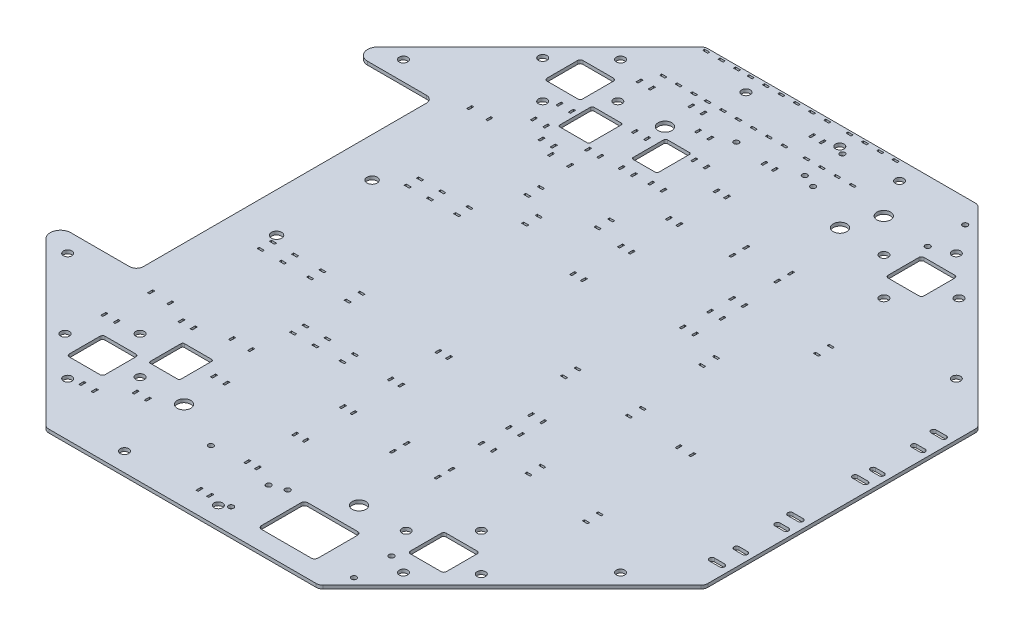
from build123d import *

# Parameters (mm, degrees)
SKETCH_1_R          = 2.5
SKETCH_1_R_2        = 4
SKETCH_1_R_3        = 3
SKETCH_1_R_4        = 1.5
SKETCH_1_W          = 3
SKETCH_1_H          = 1.2
SKETCH_1_W_2        = 1.2
SKETCH_1_H_2        = 3
EXTRUDE_1_DEPTH     = 2
CUT_EXTRUDE_1_DEPTH = 2


with BuildPart() as part:
    # 草图1 → 凸台-拉伸1 (new body)
    with BuildSketch(Plane.XZ):
        with BuildLine():
            Line((-175.894444303, -97.242640687), (-81.171572875, -191.965512115))
            ThreePointArc((-81.171572875, -191.965512115), (-79.87387948, -192.83260312), (-78.343145751, -193.13708499))
            Line((-78.343145751, -193.13708499), (78.343145751, -193.13708499))
            ThreePointArc((78.343145751, -193.13708499), (79.87387948, -192.83260312), (81.171572875, -191.965512115))
            Line((81.171572875, -191.965512115), (191.965512115, -81.171572875))
            ThreePointArc((191.965512115, -81.171572875), (192.83260312, -79.87387948), (193.13708499, -78.343145751))
            Line((193.13708499, -78.343145751), (193.13708499, 78.343145751))
            ThreePointArc((193.13708499, 78.343145751), (192.83260312, 79.87387948), (191.965512115, 81.171572875))
            Line((191.965512115, 81.171572875), (81.171572875, 191.965512115))
            ThreePointArc((81.171572875, 191.965512115), (79.87387948, 192.83260312), (78.343145751, 193.13708499))
            Line((78.343145751, 193.13708499), (-78.343145751, 193.13708499))
            ThreePointArc((-78.343145751, 193.13708499), (-79.87387948, 192.83260312), (-81.171572875, 191.965512115))
            Line((-81.171572875, 191.965512115), (-175.894444303, 97.242640687))
            ThreePointArc((-175.894444303, 97.242640687), (-177.195080811, 90.703899406), (-171.651803616, 87))
            Line((-171.651803616, 87), (-137.13708499, 87))
            ThreePointArc((-137.13708499, 87), (-134.308657865, 85.828427125), (-133.13708499, 83))
            Line((-133.13708499, 83), (-133.13708499, -83))
            ThreePointArc((-133.13708499, -83), (-134.308657865, -85.828427125), (-137.13708499, -87))
            Line((-137.13708499, -87), (-171.651803616, -87))
            ThreePointArc((-171.651803616, -87), (-177.195080811, -90.703899406), (-175.894444303, -97.242640687))
        make_face()
        with Locations((-45, -182.13708499)):
            Circle(SKETCH_1_R, mode=Mode.SUBTRACT)
        with Locations((45, -182.13708499)):
            Circle(SKETCH_1_R, mode=Mode.SUBTRACT)
        with Locations((-98.384776311, 162.024386618)):
            Circle(SKETCH_1_R, mode=Mode.SUBTRACT)
        with Locations((-162.024386618, 98.384776311)):
            Circle(SKETCH_1_R, mode=Mode.SUBTRACT)
        with Locations((162.024386618, -98.384776311)):
            Circle(SKETCH_1_R, mode=Mode.SUBTRACT)
        with Locations((98.384776311, -162.024386618)):
            Circle(SKETCH_1_R, mode=Mode.SUBTRACT)
        with Locations((-162.024386618, -98.384776311)):
            Circle(SKETCH_1_R, mode=Mode.SUBTRACT)
        with Locations((-98.384776311, -162.024386618)):
            Circle(SKETCH_1_R, mode=Mode.SUBTRACT)
        with Locations((98.384776311, 162.024386618)):
            Circle(SKETCH_1_R, mode=Mode.SUBTRACT)
        with Locations((162.024386618, 98.384776311)):
            Circle(SKETCH_1_R, mode=Mode.SUBTRACT)
        with Locations((-45, 182.13708499)):
            Circle(SKETCH_1_R, mode=Mode.SUBTRACT)
        with Locations((-78, -140)):
            Circle(SKETCH_1_R, mode=Mode.SUBTRACT)
        with Locations((-100, -118)):
            Circle(SKETCH_1_R, mode=Mode.SUBTRACT)
        with Locations((-78, 140)):
            Circle(SKETCH_1_R, mode=Mode.SUBTRACT)
        with Locations((-100, 118)):
            Circle(SKETCH_1_R, mode=Mode.SUBTRACT)
        with Locations((100, 118)):
            Circle(SKETCH_1_R, mode=Mode.SUBTRACT)
        with Locations((100, -118)):
            Circle(SKETCH_1_R, mode=Mode.SUBTRACT)
        with Locations((-122, -140)):
            Circle(SKETCH_1_R, mode=Mode.SUBTRACT)
        with Locations((-122, 140)):
            Circle(SKETCH_1_R, mode=Mode.SUBTRACT)
        with Locations((78, 140)):
            Circle(SKETCH_1_R, mode=Mode.SUBTRACT)
        with Locations((122, 140)):
            Circle(SKETCH_1_R, mode=Mode.SUBTRACT)
        with Locations((78, -140)):
            Circle(SKETCH_1_R, mode=Mode.SUBTRACT)
        with Locations((122, -140)):
            Circle(SKETCH_1_R, mode=Mode.SUBTRACT)
        with Locations((10, 182.13708499)):
            Circle(SKETCH_1_R, mode=Mode.SUBTRACT)
        with Locations((10, -182.13708499)):
            Circle(SKETCH_1_R, mode=Mode.SUBTRACT)
        with Locations((51.303021499, -140.953893118)):
            Circle(SKETCH_1_R_2, mode=Mode.SUBTRACT)
        with Locations((58.143424365, -159.747745534)):
            Circle(SKETCH_1_R_2, mode=Mode.SUBTRACT)
        with Locations((-51.303021499, -140.953893118)):
            Circle(SKETCH_1_R_2, mode=Mode.SUBTRACT)
        with Locations((-51.303021499, 140.953893118)):
            Circle(SKETCH_1_R_2, mode=Mode.SUBTRACT)
        with Locations((51.303021499, 140.953893118)):
            Circle(SKETCH_1_R_2, mode=Mode.SUBTRACT)
        with Locations((-110, 28)):
            Circle(SKETCH_1_R_3, mode=Mode.SUBTRACT)
        with Locations((-110, -28)):
            Circle(SKETCH_1_R_3, mode=Mode.SUBTRACT)
        with Locations((-22.5, 154)):
            Circle(SKETCH_1_R_4, mode=Mode.SUBTRACT)
        with Locations((22.5, 154)):
            Circle(SKETCH_1_R_4, mode=Mode.SUBTRACT)
        with Locations((-22.5, -154)):
            Circle(SKETCH_1_R_4, mode=Mode.SUBTRACT)
        with Locations((22.5, -154)):
            Circle(SKETCH_1_R_4, mode=Mode.SUBTRACT)
        with Locations((86.5, -179.13708499)):
            Circle(SKETCH_1_R_4, mode=Mode.SUBTRACT)
        with Locations((14.5, -179.13708499)):
            Circle(SKETCH_1_R_4, mode=Mode.SUBTRACT)
        with Locations((86.5, -157.13708499)):
            Circle(SKETCH_1_R_4, mode=Mode.SUBTRACT)
        with Locations((14.5, -157.13708499)):
            Circle(SKETCH_1_R_4, mode=Mode.SUBTRACT)
        with Locations((86.5, 179.13708499)):
            Circle(SKETCH_1_R_4, mode=Mode.SUBTRACT)
        with Locations((14.5, 179.13708499)):
            Circle(SKETCH_1_R_4, mode=Mode.SUBTRACT)
        with Locations((86.5, 157.13708499)):
            Circle(SKETCH_1_R_4, mode=Mode.SUBTRACT)
        with Locations((14.5, 157.13708499)):
            Circle(SKETCH_1_R_4, mode=Mode.SUBTRACT)
        with BuildLine():
            Line((182.13708499, -63.5), (188.13708499, -63.5))
            ThreePointArc((188.13708499, -63.5), (189.63708499, -65), (188.13708499, -66.5))
            Line((188.13708499, -66.5), (182.13708499, -66.5))
            ThreePointArc((182.13708499, -66.5), (180.63708499, -65), (182.13708499, -63.5))
        make_face(mode=Mode.SUBTRACT)
        with BuildLine():
            Line((182.13708499, -17.5), (188.13708499, -17.5))
            ThreePointArc((188.13708499, -17.5), (189.63708499, -19), (188.13708499, -20.5))
            Line((188.13708499, -20.5), (182.13708499, -20.5))
            ThreePointArc((182.13708499, -20.5), (180.63708499, -19), (182.13708499, -17.5))
        make_face(mode=Mode.SUBTRACT)
        with BuildLine():
            Line((182.13708499, 66.5), (188.13708499, 66.5))
            ThreePointArc((188.13708499, 66.5), (189.63708499, 65), (188.13708499, 63.5))
            Line((188.13708499, 63.5), (182.13708499, 63.5))
            ThreePointArc((182.13708499, 63.5), (180.63708499, 65), (182.13708499, 66.5))
        make_face(mode=Mode.SUBTRACT)
        with BuildLine():
            Line((182.13708499, 20.5), (188.13708499, 20.5))
            ThreePointArc((188.13708499, 20.5), (189.63708499, 19), (188.13708499, 17.5))
            Line((188.13708499, 17.5), (182.13708499, 17.5))
            ThreePointArc((182.13708499, 17.5), (180.63708499, 19), (182.13708499, 20.5))
        make_face(mode=Mode.SUBTRACT)
        with BuildLine():
            Line((183.63708499, 53.5), (188.63708499, 53.5))
            ThreePointArc((188.63708499, 53.5), (190.13708499, 52), (188.63708499, 50.5))
            Line((188.63708499, 50.5), (183.63708499, 50.5))
            ThreePointArc((183.63708499, 50.5), (182.13708499, 52), (183.63708499, 53.5))
        make_face(mode=Mode.SUBTRACT)
        with BuildLine():
            Line((188.63708499, 26.5), (183.63708499, 26.5))
            ThreePointArc((183.63708499, 26.5), (182.13708499, 28), (183.63708499, 29.5))
            Line((183.63708499, 29.5), (188.63708499, 29.5))
            ThreePointArc((188.63708499, 29.5), (190.13708499, 28), (188.63708499, 26.5))
        make_face(mode=Mode.SUBTRACT)
        with BuildLine():
            Line((188.63708499, -53.5), (183.63708499, -53.5))
            ThreePointArc((183.63708499, -53.5), (182.13708499, -52), (183.63708499, -50.5))
            Line((183.63708499, -50.5), (188.63708499, -50.5))
            ThreePointArc((188.63708499, -50.5), (190.13708499, -52), (188.63708499, -53.5))
        make_face(mode=Mode.SUBTRACT)
        with BuildLine():
            Line((183.63708499, -26.5), (188.63708499, -26.5))
            ThreePointArc((188.63708499, -26.5), (190.13708499, -28), (188.63708499, -29.5))
            Line((188.63708499, -29.5), (183.63708499, -29.5))
            ThreePointArc((183.63708499, -29.5), (182.13708499, -28), (183.63708499, -26.5))
        make_face(mode=Mode.SUBTRACT)
        with BuildLine():
            Line((-45, -134), (-45, -116))
            ThreePointArc((-45, -116), (-44.707106781, -115.292893219), (-44, -115))
            Line((-44, -115), (-31, -115))
            ThreePointArc((-31, -115), (-30.292893219, -115.292893219), (-30, -116))
            Line((-30, -116), (-30, -134))
            ThreePointArc((-30, -134), (-30.292893219, -134.707106781), (-31, -135))
            Line((-31, -135), (-44, -135))
            ThreePointArc((-44, -135), (-44.707106781, -134.707106781), (-45, -134))
        make_face(mode=Mode.SUBTRACT)
        with Locations((-96.5, -42.6)):
            Rectangle(SKETCH_1_W, SKETCH_1_H, mode=Mode.SUBTRACT)
        with Locations((-96.5, -35.4)):
            Rectangle(SKETCH_1_W, SKETCH_1_H, mode=Mode.SUBTRACT)
        with Locations((-83.5, -42.6)):
            Rectangle(SKETCH_1_W, SKETCH_1_H, mode=Mode.SUBTRACT)
        with Locations((-83.5, -35.4)):
            Rectangle(SKETCH_1_W, SKETCH_1_H, mode=Mode.SUBTRACT)
        with Locations((-67.5, -42.6)):
            Rectangle(SKETCH_1_W, SKETCH_1_H, mode=Mode.SUBTRACT)
        with Locations((-67.5, -35.4)):
            Rectangle(SKETCH_1_W, SKETCH_1_H, mode=Mode.SUBTRACT)
        with Locations((-55.5, 65.6)):
            Rectangle(SKETCH_1_W, SKETCH_1_H, mode=Mode.SUBTRACT)
        with Locations((-55.5, 72.8)):
            Rectangle(SKETCH_1_W, SKETCH_1_H, mode=Mode.SUBTRACT)
        with Locations((-42.5, 65.6)):
            Rectangle(SKETCH_1_W, SKETCH_1_H, mode=Mode.SUBTRACT)
        with Locations((-42.5, 72.8)):
            Rectangle(SKETCH_1_W, SKETCH_1_H, mode=Mode.SUBTRACT)
        with Locations((-26.5, 65.6)):
            Rectangle(SKETCH_1_W, SKETCH_1_H, mode=Mode.SUBTRACT)
        with Locations((-26.5, 72.8)):
            Rectangle(SKETCH_1_W, SKETCH_1_H, mode=Mode.SUBTRACT)
        with Locations((-107.5, 32.6)):
            Rectangle(SKETCH_1_W, SKETCH_1_H, mode=Mode.SUBTRACT)
        with Locations((-107.5, 39.8)):
            Rectangle(SKETCH_1_W, SKETCH_1_H, mode=Mode.SUBTRACT)
        with Locations((-94.5, 32.6)):
            Rectangle(SKETCH_1_W, SKETCH_1_H, mode=Mode.SUBTRACT)
        with Locations((-94.5, 39.8)):
            Rectangle(SKETCH_1_W, SKETCH_1_H, mode=Mode.SUBTRACT)
        with Locations((-78.5, 32.6)):
            Rectangle(SKETCH_1_W, SKETCH_1_H, mode=Mode.SUBTRACT)
        with Locations((-78.5, 39.8)):
            Rectangle(SKETCH_1_W, SKETCH_1_H, mode=Mode.SUBTRACT)
        with Locations((62.8, -73.5)):
            Rectangle(SKETCH_1_W_2, SKETCH_1_H_2, mode=Mode.SUBTRACT)
        with Locations((55.6, -73.5)):
            Rectangle(SKETCH_1_W_2, SKETCH_1_H_2, mode=Mode.SUBTRACT)
        with Locations((62.8, -60.5)):
            Rectangle(SKETCH_1_W_2, SKETCH_1_H_2, mode=Mode.SUBTRACT)
        with Locations((55.6, -60.5)):
            Rectangle(SKETCH_1_W_2, SKETCH_1_H_2, mode=Mode.SUBTRACT)
        with Locations((62.8, -44.5)):
            Rectangle(SKETCH_1_W_2, SKETCH_1_H_2, mode=Mode.SUBTRACT)
        with Locations((55.6, -44.5)):
            Rectangle(SKETCH_1_W_2, SKETCH_1_H_2, mode=Mode.SUBTRACT)
        with Locations((62.8, 44.5)):
            Rectangle(SKETCH_1_W_2, SKETCH_1_H_2, mode=Mode.SUBTRACT)
        with Locations((55.6, 44.5)):
            Rectangle(SKETCH_1_W_2, SKETCH_1_H_2, mode=Mode.SUBTRACT)
        with Locations((62.8, 57.5)):
            Rectangle(SKETCH_1_W_2, SKETCH_1_H_2, mode=Mode.SUBTRACT)
        with Locations((55.6, 57.5)):
            Rectangle(SKETCH_1_W_2, SKETCH_1_H_2, mode=Mode.SUBTRACT)
        with Locations((62.8, 73.5)):
            Rectangle(SKETCH_1_W_2, SKETCH_1_H_2, mode=Mode.SUBTRACT)
        with Locations((55.6, 73.5)):
            Rectangle(SKETCH_1_W_2, SKETCH_1_H_2, mode=Mode.SUBTRACT)
        with Locations((-70.6, 93.5)):
            Rectangle(SKETCH_1_W_2, SKETCH_1_H_2, mode=Mode.SUBTRACT)
        with Locations((-59.4, 93.5)):
            Rectangle(SKETCH_1_W_2, SKETCH_1_H_2, mode=Mode.SUBTRACT)
        with Locations((-106.8, 93.5)):
            Rectangle(SKETCH_1_W_2, SKETCH_1_H_2, mode=Mode.SUBTRACT)
        with Locations((-118, 93.5)):
            Rectangle(SKETCH_1_W_2, SKETCH_1_H_2, mode=Mode.SUBTRACT)
        with Locations((-70.6, -93.5)):
            Rectangle(SKETCH_1_W_2, SKETCH_1_H_2, mode=Mode.SUBTRACT)
        with Locations((-59.4, -93.5)):
            Rectangle(SKETCH_1_W_2, SKETCH_1_H_2, mode=Mode.SUBTRACT)
        with Locations((-106.8, -93.5)):
            Rectangle(SKETCH_1_W_2, SKETCH_1_H_2, mode=Mode.SUBTRACT)
        with Locations((-118, -93.5)):
            Rectangle(SKETCH_1_W_2, SKETCH_1_H_2, mode=Mode.SUBTRACT)
        with Locations((-3.6, 151.5)):
            Rectangle(SKETCH_1_W_2, SKETCH_1_H_2, mode=Mode.SUBTRACT)
        with Locations((2.6, 151.5)):
            Rectangle(SKETCH_1_W_2, SKETCH_1_H_2, mode=Mode.SUBTRACT)
        with Locations((-3.6, 123.5)):
            Rectangle(SKETCH_1_W_2, SKETCH_1_H_2, mode=Mode.SUBTRACT)
        with Locations((2.6, 123.5)):
            Rectangle(SKETCH_1_W_2, SKETCH_1_H_2, mode=Mode.SUBTRACT)
        with Locations((-3.6, 95.5)):
            Rectangle(SKETCH_1_W_2, SKETCH_1_H_2, mode=Mode.SUBTRACT)
        with Locations((2.6, 95.5)):
            Rectangle(SKETCH_1_W_2, SKETCH_1_H_2, mode=Mode.SUBTRACT)
        with Locations((-3.6, 179.5)):
            Rectangle(SKETCH_1_W_2, SKETCH_1_H_2, mode=Mode.SUBTRACT)
        with Locations((2.6, 179.5)):
            Rectangle(SKETCH_1_W_2, SKETCH_1_H_2, mode=Mode.SUBTRACT)
        with Locations((-3.6, 67.5)):
            Rectangle(SKETCH_1_W_2, SKETCH_1_H_2, mode=Mode.SUBTRACT)
        with Locations((2.6, 67.5)):
            Rectangle(SKETCH_1_W_2, SKETCH_1_H_2, mode=Mode.SUBTRACT)
        with Locations((-3.6, 39.5)):
            Rectangle(SKETCH_1_W_2, SKETCH_1_H_2, mode=Mode.SUBTRACT)
        with Locations((2.6, 39.5)):
            Rectangle(SKETCH_1_W_2, SKETCH_1_H_2, mode=Mode.SUBTRACT)
        with Locations((-3.6, -151.5)):
            Rectangle(SKETCH_1_W_2, SKETCH_1_H_2, mode=Mode.SUBTRACT)
        with Locations((2.6, -151.5)):
            Rectangle(SKETCH_1_W_2, SKETCH_1_H_2, mode=Mode.SUBTRACT)
        with Locations((-3.6, -123.5)):
            Rectangle(SKETCH_1_W_2, SKETCH_1_H_2, mode=Mode.SUBTRACT)
        with Locations((2.6, -123.5)):
            Rectangle(SKETCH_1_W_2, SKETCH_1_H_2, mode=Mode.SUBTRACT)
        with Locations((-3.6, -95.5)):
            Rectangle(SKETCH_1_W_2, SKETCH_1_H_2, mode=Mode.SUBTRACT)
        with Locations((2.6, -95.5)):
            Rectangle(SKETCH_1_W_2, SKETCH_1_H_2, mode=Mode.SUBTRACT)
        with Locations((-3.6, -179.5)):
            Rectangle(SKETCH_1_W_2, SKETCH_1_H_2, mode=Mode.SUBTRACT)
        with Locations((2.6, -179.5)):
            Rectangle(SKETCH_1_W_2, SKETCH_1_H_2, mode=Mode.SUBTRACT)
        with Locations((-3.6, -67.5)):
            Rectangle(SKETCH_1_W_2, SKETCH_1_H_2, mode=Mode.SUBTRACT)
        with Locations((2.6, -67.5)):
            Rectangle(SKETCH_1_W_2, SKETCH_1_H_2, mode=Mode.SUBTRACT)
        with Locations((-3.6, -39.5)):
            Rectangle(SKETCH_1_W_2, SKETCH_1_H_2, mode=Mode.SUBTRACT)
        with Locations((2.6, -39.5)):
            Rectangle(SKETCH_1_W_2, SKETCH_1_H_2, mode=Mode.SUBTRACT)
        with Locations((60, -103.5)):
            Rectangle(SKETCH_1_W_2, SKETCH_1_H_2, mode=Mode.SUBTRACT)
        with Locations((33.8, -103.5)):
            Rectangle(SKETCH_1_W_2, SKETCH_1_H_2, mode=Mode.SUBTRACT)
        with Locations((60, -95.5)):
            Rectangle(SKETCH_1_W_2, SKETCH_1_H_2, mode=Mode.SUBTRACT)
        with Locations((33.8, -95.5)):
            Rectangle(SKETCH_1_W_2, SKETCH_1_H_2, mode=Mode.SUBTRACT)
        with Locations((60, 103.5)):
            Rectangle(SKETCH_1_W_2, SKETCH_1_H_2, mode=Mode.SUBTRACT)
        with Locations((33.8, 103.5)):
            Rectangle(SKETCH_1_W_2, SKETCH_1_H_2, mode=Mode.SUBTRACT)
        with Locations((60, 95.5)):
            Rectangle(SKETCH_1_W_2, SKETCH_1_H_2, mode=Mode.SUBTRACT)
        with Locations((33.8, 95.5)):
            Rectangle(SKETCH_1_W_2, SKETCH_1_H_2, mode=Mode.SUBTRACT)
        with Locations((-42.8, -58.5)):
            Rectangle(SKETCH_1_W, SKETCH_1_H, mode=Mode.SUBTRACT)
        with Locations((-42.8, -50.5)):
            Rectangle(SKETCH_1_W, SKETCH_1_H, mode=Mode.SUBTRACT)
        with Locations((-56.8, -73.7)):
            Rectangle(SKETCH_1_W, SKETCH_1_H, mode=Mode.SUBTRACT)
        with Locations((-56.8, -65.7)):
            Rectangle(SKETCH_1_W, SKETCH_1_H, mode=Mode.SUBTRACT)
        with Locations((-19.7, -77.838637452)):
            Rectangle(SKETCH_1_W, SKETCH_1_H, mode=Mode.SUBTRACT)
        with Locations((-19.7, -69.838637452)):
            Rectangle(SKETCH_1_W, SKETCH_1_H, mode=Mode.SUBTRACT)
        with Locations((-55.7, 32.6)):
            Rectangle(SKETCH_1_W, SKETCH_1_H, mode=Mode.SUBTRACT)
        with Locations((-55.7, 40.6)):
            Rectangle(SKETCH_1_W, SKETCH_1_H, mode=Mode.SUBTRACT)
        with Locations((85.1, 67.4)):
            Rectangle(SKETCH_1_W, SKETCH_1_H, mode=Mode.SUBTRACT)
        with Locations((85.1, 75.4)):
            Rectangle(SKETCH_1_W, SKETCH_1_H, mode=Mode.SUBTRACT)
        with Locations((126.1, 74.729301181)):
            Rectangle(SKETCH_1_W, SKETCH_1_H, mode=Mode.SUBTRACT)
        with Locations((126.1, 82.729301181)):
            Rectangle(SKETCH_1_W, SKETCH_1_H, mode=Mode.SUBTRACT)
        with Locations((85.1, 8.6)):
            Rectangle(SKETCH_1_W, SKETCH_1_H, mode=Mode.SUBTRACT)
        with Locations((85.1, 16.6)):
            Rectangle(SKETCH_1_W, SKETCH_1_H, mode=Mode.SUBTRACT)
        with Locations((46.1, 7.6)):
            Rectangle(SKETCH_1_W, SKETCH_1_H, mode=Mode.SUBTRACT)
        with Locations((46.1, 15.6)):
            Rectangle(SKETCH_1_W, SKETCH_1_H, mode=Mode.SUBTRACT)
        with Locations((123.2, 17.5)):
            Rectangle(SKETCH_1_W_2, SKETCH_1_H_2, mode=Mode.SUBTRACT)
        with Locations((115.2, 17.5)):
            Rectangle(SKETCH_1_W_2, SKETCH_1_H_2, mode=Mode.SUBTRACT)
        with Locations((80.766326716, -38.8)):
            Rectangle(SKETCH_1_W, SKETCH_1_H, mode=Mode.SUBTRACT)
        with Locations((80.766326716, -30.6)):
            Rectangle(SKETCH_1_W, SKETCH_1_H, mode=Mode.SUBTRACT)
        with Locations((108.766326716, -78)):
            Rectangle(SKETCH_1_W, SKETCH_1_H, mode=Mode.SUBTRACT)
        with Locations((108.766326716, -70)):
            Rectangle(SKETCH_1_W, SKETCH_1_H, mode=Mode.SUBTRACT)
        with BuildLine():
            Line((-110.5, 131), (-110.5, 149))
            ThreePointArc((-110.5, 149), (-110.060660172, 150.060660172), (-109, 150.5))
            Line((-109, 150.5), (-91, 150.5))
            ThreePointArc((-91, 150.5), (-89.939339828, 150.060660172), (-89.5, 149))
            Line((-89.5, 149), (-89.5, 131))
            ThreePointArc((-89.5, 131), (-89.939339828, 129.939339828), (-91, 129.5))
            Line((-91, 129.5), (-109, 129.5))
            ThreePointArc((-109, 129.5), (-110.060660172, 129.939339828), (-110.5, 131))
        make_face(mode=Mode.SUBTRACT)
        with BuildLine():
            Line((-110.5, -149), (-110.5, -131))
            ThreePointArc((-110.5, -131), (-110.060660172, -129.939339828), (-109, -129.5))
            Line((-109, -129.5), (-91, -129.5))
            ThreePointArc((-91, -129.5), (-89.939339828, -129.939339828), (-89.5, -131))
            Line((-89.5, -131), (-89.5, -149))
            ThreePointArc((-89.5, -149), (-89.939339828, -150.060660172), (-91, -150.5))
            Line((-91, -150.5), (-109, -150.5))
            ThreePointArc((-109, -150.5), (-110.060660172, -150.060660172), (-110.5, -149))
        make_face(mode=Mode.SUBTRACT)
        with BuildLine():
            Line((109, -150.5), (91, -150.5))
            ThreePointArc((91, -150.5), (89.939339828, -150.060660172), (89.5, -149))
            Line((89.5, -149), (89.5, -131))
            ThreePointArc((89.5, -131), (89.939339828, -129.939339828), (91, -129.5))
            Line((91, -129.5), (109, -129.5))
            ThreePointArc((109, -129.5), (110.060660172, -129.939339828), (110.5, -131))
            Line((110.5, -131), (110.5, -149))
            ThreePointArc((110.5, -149), (110.060660172, -150.060660172), (109, -150.5))
        make_face(mode=Mode.SUBTRACT)
        with BuildLine():
            Line((109, 129.5), (91, 129.5))
            ThreePointArc((91, 129.5), (89.939339828, 129.939339828), (89.5, 131))
            Line((89.5, 131), (89.5, 149))
            ThreePointArc((89.5, 149), (89.939339828, 150.060660172), (91, 150.5))
            Line((91, 150.5), (109, 150.5))
            ThreePointArc((109, 150.5), (110.060660172, 150.060660172), (110.5, 149))
            Line((110.5, 149), (110.5, 131))
            ThreePointArc((110.5, 131), (110.060660172, 129.939339828), (109, 129.5))
        make_face(mode=Mode.SUBTRACT)
        with BuildLine():
            Line((-83, -129), (-83, -111))
            ThreePointArc((-83, -111), (-82.707106781, -110.292893219), (-82, -110))
            Line((-82, -110), (-66, -110))
            ThreePointArc((-66, -110), (-65.292893219, -110.292893219), (-65, -111))
            Line((-65, -111), (-65, -129))
            ThreePointArc((-65, -129), (-65.292893219, -129.707106781), (-66, -130))
            Line((-66, -130), (-82, -130))
            ThreePointArc((-82, -130), (-82.707106781, -129.707106781), (-83, -129))
        make_face(mode=Mode.SUBTRACT)
        with BuildLine():
            Line((-83, 111), (-83, 129))
            ThreePointArc((-83, 129), (-82.707106781, 129.707106781), (-82, 130))
            Line((-82, 130), (-66, 130))
            ThreePointArc((-66, 130), (-65.292893219, 129.707106781), (-65, 129))
            Line((-65, 129), (-65, 111))
            ThreePointArc((-65, 111), (-65.292893219, 110.292893219), (-66, 110))
            Line((-66, 110), (-82, 110))
            ThreePointArc((-82, 110), (-82.707106781, 110.292893219), (-83, 111))
        make_face(mode=Mode.SUBTRACT)
        with Locations((-93.6, -121.5)):
            Rectangle(SKETCH_1_W_2, SKETCH_1_H_2, mode=Mode.SUBTRACT)
        with Locations((-86.4, -121.5)):
            Rectangle(SKETCH_1_W_2, SKETCH_1_H_2, mode=Mode.SUBTRACT)
        with Locations((-93.6, -106.5)):
            Rectangle(SKETCH_1_W_2, SKETCH_1_H_2, mode=Mode.SUBTRACT)
        with Locations((-86.4, -106.5)):
            Rectangle(SKETCH_1_W_2, SKETCH_1_H_2, mode=Mode.SUBTRACT)
        with Locations((-81.2, -98.5)):
            Rectangle(SKETCH_1_W_2, SKETCH_1_H_2, mode=Mode.SUBTRACT)
        with Locations((-74, -98.5)):
            Rectangle(SKETCH_1_W_2, SKETCH_1_H_2, mode=Mode.SUBTRACT)
        with Locations((-62.355257359, -106.964559067)):
            Rectangle(SKETCH_1_W_2, SKETCH_1_H_2, mode=Mode.SUBTRACT)
        with Locations((-55.155257359, -106.964559067)):
            Rectangle(SKETCH_1_W_2, SKETCH_1_H_2, mode=Mode.SUBTRACT)
        with Locations((-43.243537333, -107.43551822)):
            Rectangle(SKETCH_1_W_2, SKETCH_1_H_2, mode=Mode.SUBTRACT)
        with Locations((-36.043537333, -107.43551822)):
            Rectangle(SKETCH_1_W_2, SKETCH_1_H_2, mode=Mode.SUBTRACT)
        with Locations((-57.681893458, -129.672694442)):
            Rectangle(SKETCH_1_W_2, SKETCH_1_H_2, mode=Mode.SUBTRACT)
        with Locations((-50.481893458, -129.672694442)):
            Rectangle(SKETCH_1_W_2, SKETCH_1_H_2, mode=Mode.SUBTRACT)
        with Locations((-26.674338047, -108.281927327)):
            Rectangle(SKETCH_1_W_2, SKETCH_1_H_2, mode=Mode.SUBTRACT)
        with Locations((-19.474338047, -108.281927327)):
            Rectangle(SKETCH_1_W_2, SKETCH_1_H_2, mode=Mode.SUBTRACT)
        with Locations((-25.831222361, -132.732282225)):
            Rectangle(SKETCH_1_W_2, SKETCH_1_H_2, mode=Mode.SUBTRACT)
        with Locations((-18.631222361, -132.732282225)):
            Rectangle(SKETCH_1_W_2, SKETCH_1_H_2, mode=Mode.SUBTRACT)
        with Locations((-81.919822724, -156.688624026)):
            Rectangle(SKETCH_1_W_2, SKETCH_1_H_2, mode=Mode.SUBTRACT)
        with Locations((-74.719822724, -156.688624026)):
            Rectangle(SKETCH_1_W_2, SKETCH_1_H_2, mode=Mode.SUBTRACT)
        with Locations((-54.123352447, -159.191623719)):
            Rectangle(SKETCH_1_W_2, SKETCH_1_H_2, mode=Mode.SUBTRACT)
        with Locations((-46.923352447, -159.191623719)):
            Rectangle(SKETCH_1_W_2, SKETCH_1_H_2, mode=Mode.SUBTRACT)
        with Locations((-39.368827939, -148.38920399)):
            Rectangle(SKETCH_1_W_2, SKETCH_1_H_2, mode=Mode.SUBTRACT)
        with Locations((-32.168827939, -148.38920399)):
            Rectangle(SKETCH_1_W_2, SKETCH_1_H_2, mode=Mode.SUBTRACT)
        with Locations((-94.460278303, 99.28239438)):
            Rectangle(SKETCH_1_W_2, SKETCH_1_H_2, mode=Mode.SUBTRACT)
        with Locations((-87.260278303, 99.28239438)):
            Rectangle(SKETCH_1_W_2, SKETCH_1_H_2, mode=Mode.SUBTRACT)
        with Locations((-120.280696191, 118.61477359)):
            Rectangle(SKETCH_1_W_2, SKETCH_1_H_2, mode=Mode.SUBTRACT)
        with Locations((-113.080696191, 118.61477359)):
            Rectangle(SKETCH_1_W_2, SKETCH_1_H_2, mode=Mode.SUBTRACT)
        with Locations((-56.882348698, 117.791418428)):
            Rectangle(SKETCH_1_W_2, SKETCH_1_H_2, mode=Mode.SUBTRACT)
        with Locations((-49.682348698, 117.791418428)):
            Rectangle(SKETCH_1_W_2, SKETCH_1_H_2, mode=Mode.SUBTRACT)
        with Locations((-71.702741618, 148.914243561)):
            Rectangle(SKETCH_1_W_2, SKETCH_1_H_2, mode=Mode.SUBTRACT)
        with Locations((-64.502741618, 148.914243561)):
            Rectangle(SKETCH_1_W_2, SKETCH_1_H_2, mode=Mode.SUBTRACT)
        with Locations((-91.627936545, 160.111873767)):
            Rectangle(SKETCH_1_W_2, SKETCH_1_H_2, mode=Mode.SUBTRACT)
        with Locations((-84.427936545, 160.111873767)):
            Rectangle(SKETCH_1_W_2, SKETCH_1_H_2, mode=Mode.SUBTRACT)
        with Locations((-59.5, -166.13708499)):
            Rectangle(SKETCH_1_W, SKETCH_1_H, mode=Mode.SUBTRACT)
        with Locations((-51.5, -166.13708499)):
            Rectangle(SKETCH_1_W, SKETCH_1_H, mode=Mode.SUBTRACT)
        with Locations((-42.5, -166.13708499)):
            Rectangle(SKETCH_1_W, SKETCH_1_H, mode=Mode.SUBTRACT)
        with Locations((-33.5, -166.13708499)):
            Rectangle(SKETCH_1_W, SKETCH_1_H, mode=Mode.SUBTRACT)
        with Locations((-24.5, -166.13708499)):
            Rectangle(SKETCH_1_W, SKETCH_1_H, mode=Mode.SUBTRACT)
        with Locations((-15.5, -166.13708499)):
            Rectangle(SKETCH_1_W, SKETCH_1_H, mode=Mode.SUBTRACT)
        with Locations((-6.5, -166.13708499)):
            Rectangle(SKETCH_1_W, SKETCH_1_H, mode=Mode.SUBTRACT)
        with Locations((33.5, -166.13708499)):
            Rectangle(SKETCH_1_W, SKETCH_1_H, mode=Mode.SUBTRACT)
        with Locations((24.5, -166.13708499)):
            Rectangle(SKETCH_1_W, SKETCH_1_H, mode=Mode.SUBTRACT)
        with Locations((15.5, -166.13708499)):
            Rectangle(SKETCH_1_W, SKETCH_1_H, mode=Mode.SUBTRACT)
        with Locations((6.5, -166.13708499)):
            Rectangle(SKETCH_1_W, SKETCH_1_H, mode=Mode.SUBTRACT)
        with Locations((-59.5, -191.33708499)):
            Rectangle(SKETCH_1_W, SKETCH_1_H, mode=Mode.SUBTRACT)
        with Locations((-51.5, -191.33708499)):
            Rectangle(SKETCH_1_W, SKETCH_1_H, mode=Mode.SUBTRACT)
        with Locations((-42.5, -191.33708499)):
            Rectangle(SKETCH_1_W, SKETCH_1_H, mode=Mode.SUBTRACT)
        with Locations((-33.5, -191.33708499)):
            Rectangle(SKETCH_1_W, SKETCH_1_H, mode=Mode.SUBTRACT)
        with Locations((-24.5, -191.33708499)):
            Rectangle(SKETCH_1_W, SKETCH_1_H, mode=Mode.SUBTRACT)
        with Locations((-15.5, -191.33708499)):
            Rectangle(SKETCH_1_W, SKETCH_1_H, mode=Mode.SUBTRACT)
        with Locations((-6.5, -191.33708499)):
            Rectangle(SKETCH_1_W, SKETCH_1_H, mode=Mode.SUBTRACT)
        with Locations((33.5, -191.33708499)):
            Rectangle(SKETCH_1_W, SKETCH_1_H, mode=Mode.SUBTRACT)
        with Locations((24.5, -191.33708499)):
            Rectangle(SKETCH_1_W, SKETCH_1_H, mode=Mode.SUBTRACT)
        with Locations((15.5, -191.33708499)):
            Rectangle(SKETCH_1_W, SKETCH_1_H, mode=Mode.SUBTRACT)
        with Locations((6.5, -191.33708499)):
            Rectangle(SKETCH_1_W, SKETCH_1_H, mode=Mode.SUBTRACT)
        with Locations((-68.5, -166.13708499)):
            Rectangle(SKETCH_1_W, SKETCH_1_H, mode=Mode.SUBTRACT)
        with Locations((-77.5, -166.13708499)):
            Rectangle(SKETCH_1_W, SKETCH_1_H, mode=Mode.SUBTRACT)
        with Locations((-68.5, -191.33708499)):
            Rectangle(SKETCH_1_W, SKETCH_1_H, mode=Mode.SUBTRACT)
        with Locations((-77.5, -191.33708499)):
            Rectangle(SKETCH_1_W, SKETCH_1_H, mode=Mode.SUBTRACT)
    extrude(amount=-EXTRUDE_1_DEPTH)

    # 草图2 → 切除-拉伸1 (cut)
    with BuildSketch(Plane(origin=(0, 2, 0), x_dir=(-1, 0, 0), z_dir=(0, 1, 0))):
        with BuildLine():
            Line((-66.028547625, 179.704392584), (-66.028547625, 156.604392584))
            ThreePointArc((-66.028547625, 156.604392584), (-65.442761187, 155.190179022), (-64.028547625, 154.604392584))
            Line((-64.028547625, 154.604392584), (-34.928547625, 154.604392584))
            ThreePointArc((-34.928547625, 154.604392584), (-33.514334063, 155.190179022), (-32.928547625, 156.604392584))
            Line((-32.928547625, 156.604392584), (-32.928547625, 179.704392584))
            ThreePointArc((-32.928547625, 179.704392584), (-33.514334063, 181.118606147), (-34.928547625, 181.704392584))
            Line((-34.928547625, 181.704392584), (-64.028547625, 181.704392584))
            ThreePointArc((-64.028547625, 181.704392584), (-65.442761187, 181.118606147), (-66.028547625, 179.704392584))
        make_face()
    extrude(amount=-CUT_EXTRUDE_1_DEPTH, mode=Mode.SUBTRACT)


solid = part.part
